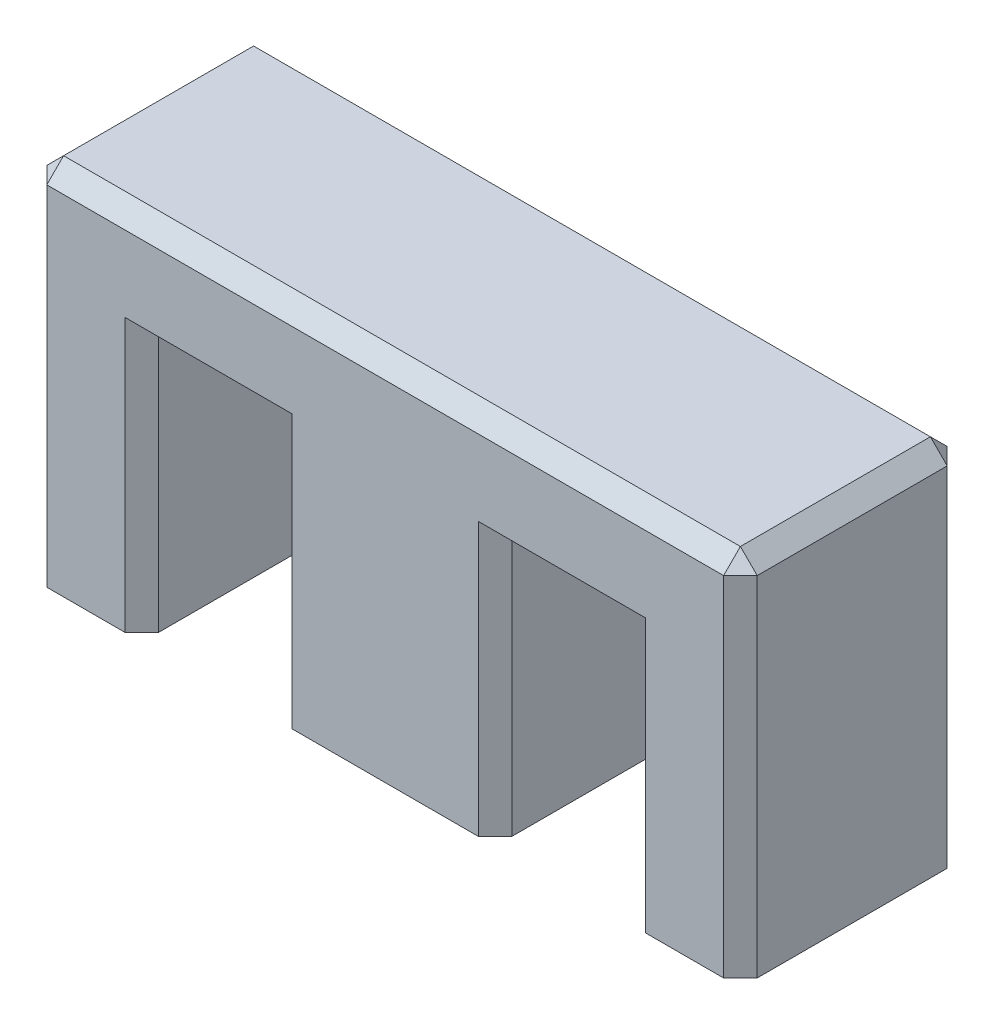
from build123d import *

# Parameters (mm, degrees)
BOSS_EXTRUDE1_DEPTH = 13.3
CHAMFER1_SIZE       = 2


with BuildPart() as part:
    # Sketch1 → Boss-Extrude1 (new, symmetric)
    with BuildSketch(Plane.XY):
        Polygon((42.25, 31.023529412), (-42.25, 31.023529412), (-42.25, -12.426470588), (-28.95, -12.426470588), (-28.95, 18.023529412), (-13.075, 18.023529412), (-13.075, -12.426470588), (13.075, -12.426470588), (13.075, 18.023529412), (28.95, 18.023529412), (28.95, -12.426470588), (42.25, -12.426470588), align=None)
    extrude(amount=BOSS_EXTRUDE1_DEPTH, both=True)

    # Chamfer1
    chamfer1_edges = [part.edges().sort_by_distance(p)[0] for p in [
        (42.25, 31.023529412, 0),
        (42.25, 9.298529412, 13.3),
        (0, 31.023529412, 13.3),
        (-42.25, 9.298529412, 13.3),
        (-42.25, 31.023529412, 0),
        (-42.25, 9.298529412, -13.3),
        (0, 31.023529412, -13.3),
        (42.25, 9.298529412, -13.3),
        (13.075, 2.798529412, -13.3),
        (28.95, 2.798529412, -13.3),
        (21.0125, 18.023529412, -13.3),
        (-28.95, 2.798529412, -13.3),
        (-13.075, 2.798529412, -13.3),
        (-21.0125, 18.023529412, -13.3),
        (28.95, 2.798529412, 13.3),
        (13.075, 2.798529412, 13.3),
        (21.0125, 18.023529412, 13.3),
        (-28.95, 2.798529412, 13.3),
        (-13.075, 2.798529412, 13.3),
        (-21.0125, 18.023529412, 13.3),
    ]]
    chamfer(chamfer1_edges, length=CHAMFER1_SIZE)


solid = part.part
